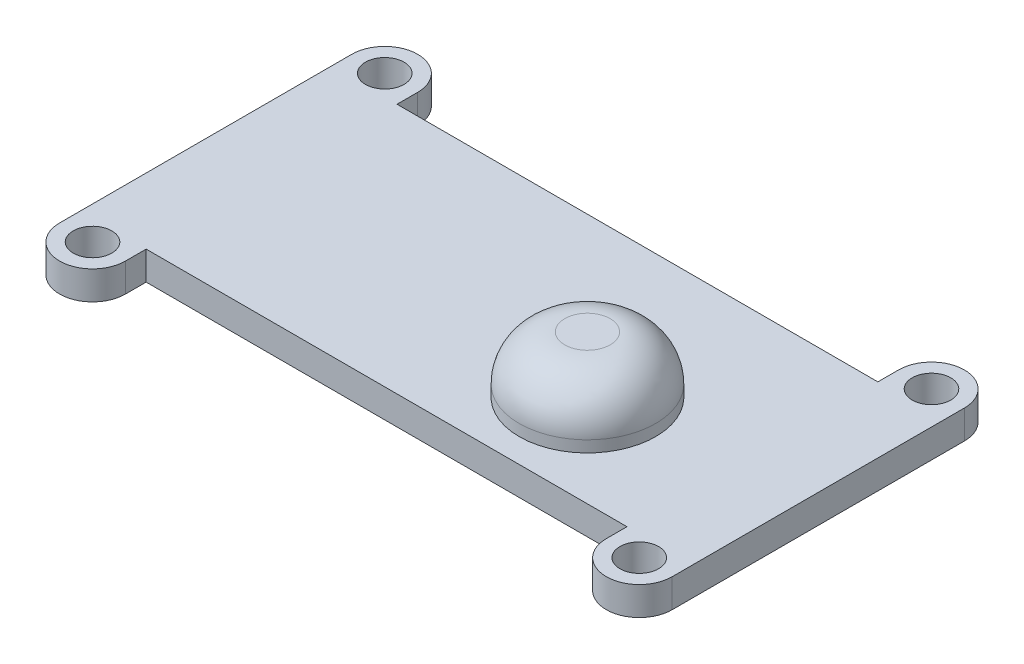
from build123d import *

# Parameters (mm, degrees)
SKETCH1_R           = 1.0795
BOSS_EXTRUDE1_DEPTH = 0.8001
SKETCH2_R           = 3.81
BOSS_EXTRUDE2_DEPTH = 3.175
FILLET1_R           = 2.54


with BuildPart() as part:
    # Sketch1 → Boss-Extrude1 (new, symmetric)
    with BuildSketch(Plane(origin=(0, 0, 0), x_dir=(1, 0, 0), z_dir=(0, 1, 0))):
        with BuildLine():
            Line((-13.4366, -7.0104), (13.4366, -7.0104))
            Line((13.4366, -7.0104), (13.4366, -8.1661))
            ThreePointArc((13.4366, -8.1661), (15.2781, -10.0076), (17.1196, -8.1661))
            Line((17.1196, -8.1661), (17.1196, -7.0104))
            Line((17.1196, -7.0104), (17.1196, 7.0104))
            Line((17.1196, 7.0104), (17.1196, 8.1661))
            ThreePointArc((17.1196, 8.1661), (15.2781, 10.0076), (13.4366, 8.1661))
            Line((13.4366, 8.1661), (13.4366, 7.0104))
            Line((13.4366, 7.0104), (-13.4366, 7.0104))
            Line((-13.4366, 7.0104), (-13.4366, 8.1661))
            ThreePointArc((-13.4366, 8.1661), (-15.2781, 10.0076), (-17.1196, 8.1661))
            Line((-17.1196, 8.1661), (-17.1196, 7.0104))
            Line((-17.1196, 7.0104), (-17.1196, -7.0104))
            Line((-17.1196, -7.0104), (-17.1196, -8.1661))
            ThreePointArc((-17.1196, -8.1661), (-15.2781, -10.0076), (-13.4366, -8.1661))
            Line((-13.4366, -8.1661), (-13.4366, -7.0104))
        make_face()
        with Locations((-15.2781, 8.1661)):
            Circle(SKETCH1_R, mode=Mode.SUBTRACT)
        with Locations((-15.2781, -8.1661)):
            Circle(SKETCH1_R, mode=Mode.SUBTRACT)
        with Locations((15.2781, 8.1661)):
            Circle(SKETCH1_R, mode=Mode.SUBTRACT)
        with Locations((15.2781, -8.1661)):
            Circle(SKETCH1_R, mode=Mode.SUBTRACT)
    extrude(amount=BOSS_EXTRUDE1_DEPTH, both=True)

    # Sketch2 → Boss-Extrude2 (add)
    with BuildSketch(Plane(origin=(0, 0.8001, 0), x_dir=(1, 0, 0), z_dir=(0, 1, 0))):
        with Locations((6.0706, -1.8542)):
            Circle(SKETCH2_R)
    extrude(amount=BOSS_EXTRUDE2_DEPTH)

    # Fillet1
    fillet1_edges = [part.edges().sort_by_distance(p)[0] for p in [
        (2.2606, 3.9751, 1.8542),
    ]]
    fillet(fillet1_edges, radius=FILLET1_R)


solid = part.part
